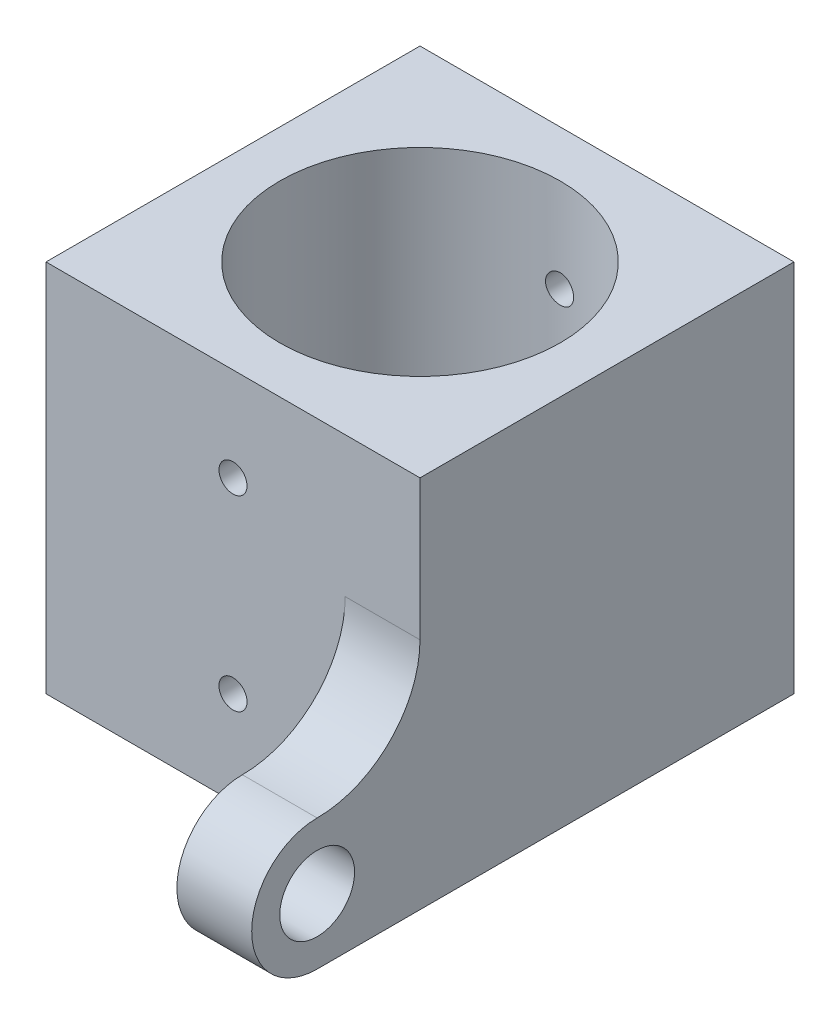
from build123d import *

# Parameters (mm, degrees)
SKETCH_1_W          = 40
SKETCH_1_H          = 40
SKETCH_1_R          = 15
EXTRUDE_1_DEPTH     = 40
SKETCH_2_R          = 1.5
CUT_EXTRUDE_1_DEPTH = 61
SKETCH_3_R          = 4
EXTRUDE_2_DEPTH     = 8
FILLET_1_R          = 11


with BuildPart() as part:
    # 草圖1 → 填料-伸長1 (new body)
    with BuildSketch(Plane(origin=(0, 0, 0), x_dir=(1, 0, 0), z_dir=(0, 1, 0))):
        Rectangle(SKETCH_1_W, SKETCH_1_H)
        with Locations(Location((0, 0, 0), (0, 0, 270))):
            Circle(SKETCH_1_R, mode=Mode.SUBTRACT)
    extrude(amount=EXTRUDE_1_DEPTH)

    # 草圖2 → 除料-伸長1 (cut, through all)
    with BuildSketch(Plane.XY.offset(20)):
        with Locations((0, 10)):
            Circle(SKETCH_2_R)
        with Locations((0, 30)):
            Circle(SKETCH_2_R)
    extrude(amount=-CUT_EXTRUDE_1_DEPTH, mode=Mode.SUBTRACT)

    # 草圖3 → 填料-伸長2 (add)
    with BuildSketch(Plane(origin=(20, 0, 0), x_dir=(0, 0, -1), z_dir=(1, 0, 0))):
        with BuildLine():
            Line((-20, 0), (-31, 0))
            ThreePointArc((-31, 0), (-38, 7), (-31, 14))
            Line((-31, 14), (-20, 14))
            Line((-20, 14), (-20, 0))
        make_face()
        with Locations((-31, 7)):
            Circle(SKETCH_3_R, mode=Mode.SUBTRACT)
    extrude(amount=-EXTRUDE_2_DEPTH)

    # 圓角1
    fillet_1_edges = [part.edges().sort_by_distance(p)[0] for p in [
        (16, 14, 20),
    ]]
    fillet(fillet_1_edges, radius=FILLET_1_R - 0.0001)  # a hair under: the kernel refuses the full size


solid = part.part
